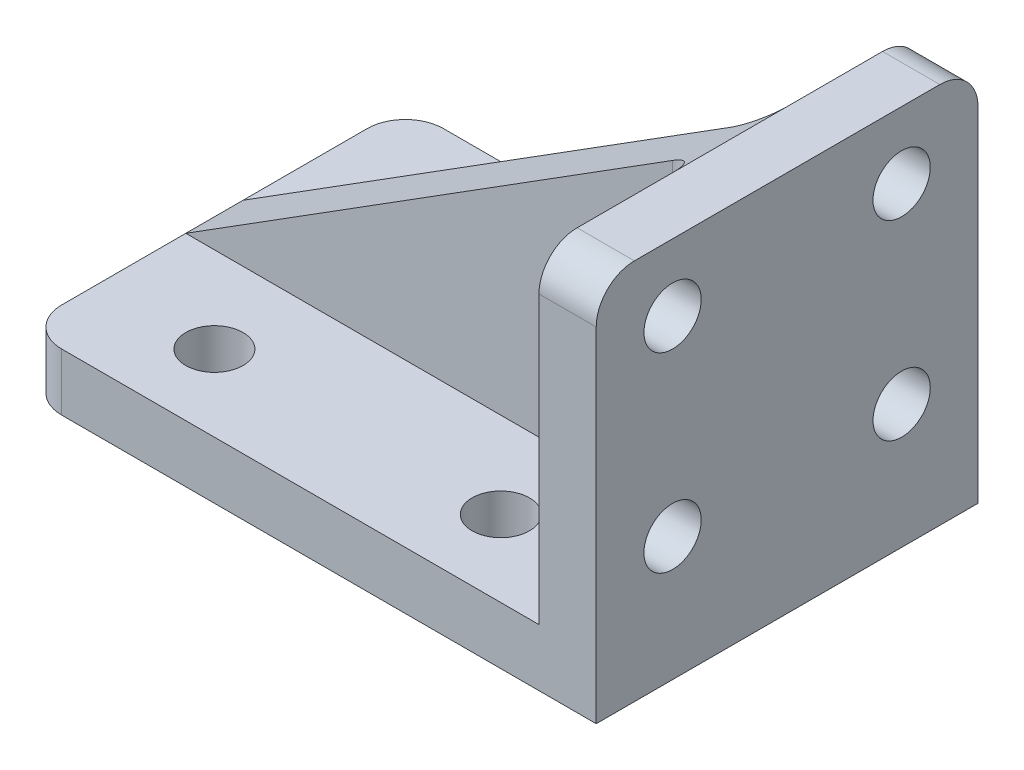
from build123d import *

# Parameters (mm, degrees)
SKETCH_1_W           = 30
SKETCH_1_H           = 20
EXTRUDE_1_DEPTH      = 3
SKETCH_2_W           = 20
SKETCH_2_H           = 17
EXTRUDE_2_DEPTH      = 3
EXTRUDE_3_DEPTH      = 1.5
EXTRUDE_3_DEPTH_BACK = 1.5
SKETCH_4_R           = 1.5
CUT_EXTRUDE_1_DEPTH  = 40.862262856
SKETCH_5_R           = 1.5
CUT_EXTRUDE_2_DEPTH  = 40.102429592
FILLET_1_R           = 1.5
FILLET_2_R           = 2


with BuildPart() as part:
    # 草图1 → 凸台-拉伸1 (new body)
    with BuildSketch(Plane(origin=(0, 0, 0), x_dir=(1, 0, 0), z_dir=(0, 1, 0))):
        with Locations((15, 10)):
            Rectangle(SKETCH_1_W, SKETCH_1_H)
    extrude(amount=EXTRUDE_1_DEPTH)

    # 草图2 → 凸台-拉伸2 (add)
    with BuildSketch(Plane(origin=(30, 0, 0), x_dir=(0, 0, -1), z_dir=(1, 0, 0))):
        with Locations((10, 11.5)):
            Rectangle(SKETCH_2_W, SKETCH_2_H)
    extrude(amount=-EXTRUDE_2_DEPTH)

    # 草图3 → 凸台-拉伸3 (add, two sides: drawn at the far end of the back side and taken through both)
    with BuildSketch(Plane.XY.offset(-10).offset(-EXTRUDE_3_DEPTH_BACK)):
        Polygon((27, 20), (0, 3), (27, 3), align=None)
    extrude(amount=EXTRUDE_3_DEPTH + EXTRUDE_3_DEPTH_BACK)

    # 草图4 → 切除-拉伸1 (cut, through all)
    with BuildSketch(Plane(origin=(0, 3, 0), x_dir=(1, 0, 0), z_dir=(0, 1, 0))):
        with Locations(Location((6, 16, 0), (0, 0, 270))):
            Circle(SKETCH_4_R)
        with Locations(Location((21, 16, 0), (0, 0, 90))):
            Circle(SKETCH_4_R)
        with Locations(Location((21, 4, 0), (0, 0, 270))):
            Circle(SKETCH_4_R)
        with Locations(Location((6, 4, 0), (0, 0, 90))):
            Circle(SKETCH_4_R)
    extrude(amount=-CUT_EXTRUDE_1_DEPTH, mode=Mode.SUBTRACT)

    # 草图5 → 切除-拉伸2 (cut, through all)
    with BuildSketch(Plane.ZY.offset(-27)):
        with Locations((-16, 16.5)):
            Circle(SKETCH_5_R)
        with Locations(Location((-16, 6.5, 0), (0, 0, 180))):
            Circle(SKETCH_5_R)
        with Locations((-4, 6.5)):
            Circle(SKETCH_5_R)
        with Locations(Location((-4, 16.5, 0), (0, 0, 180))):
            Circle(SKETCH_5_R)
    extrude(amount=-CUT_EXTRUDE_2_DEPTH, mode=Mode.SUBTRACT)

    # 圆角1
    # the kernel refuses this fillet: 1.5 mm, written as the material it adds along each edge
    with BuildSketch(Plane(origin=(27, 3, -11.5), x_dir=(0, 0, -1), z_dir=(0, 1, 0))) as fillet_1_piece_1_section:
        with BuildLine():
            CenterArc((FILLET_1_R, FILLET_1_R), FILLET_1_R, 180, 90)
            Line((0, FILLET_1_R), (0, 0))
            Line((0, 0), (FILLET_1_R, 0))
        make_face()
    fillet_1_piece_1 = extrude(amount=20.75, mode=Mode.PRIVATE)
    fillet_1_piece_1 = split(fillet_1_piece_1, bisect_by=Plane(origin=(22.882537892, 17.407523858, -11.836797175), z_dir=(0.5328132696861393, -0.8462328400897506, 0)), keep=Keep.TOP, mode=Mode.PRIVATE)
    add(fillet_1_piece_1)
    with BuildSketch(Plane(origin=(27, -0.75, -8.5), x_dir=(0, 0, 1), z_dir=(0, 1, 0))) as fillet_1_piece_2_section:
        with BuildLine():
            CenterArc((FILLET_1_R, -FILLET_1_R), FILLET_1_R, 90, 90)
            Line((0, -FILLET_1_R), (0, 0))
            Line((0, 0), (FILLET_1_R, 0))
        make_face()
    fillet_1_piece_2 = extrude(amount=24.5, mode=Mode.PRIVATE)
    fillet_1_piece_2 = split(fillet_1_piece_2, bisect_by=Plane(origin=(26.667914796, 0, -8.163202825), z_dir=(0, 1, 0)), keep=Keep.TOP, mode=Mode.PRIVATE)
    fillet_1_piece_2 = split(fillet_1_piece_2, bisect_by=Plane(origin=(22.882537892, 17.407523858, -8.163202825), z_dir=(0.5328132696861393, -0.8462328400897506, 0)), keep=Keep.TOP, mode=Mode.PRIVATE)
    add(fillet_1_piece_2)

    # 圆角2
    fillet_2_edges = [part.edges().sort_by_distance(p)[0] for p in [
        (28.5, 20, 0),
        (28.5, 20, -20),
        (0, 1.5, -20),
        (0, 1.5, 0),
    ]]
    fillet(fillet_2_edges, radius=FILLET_2_R)


solid = part.part
